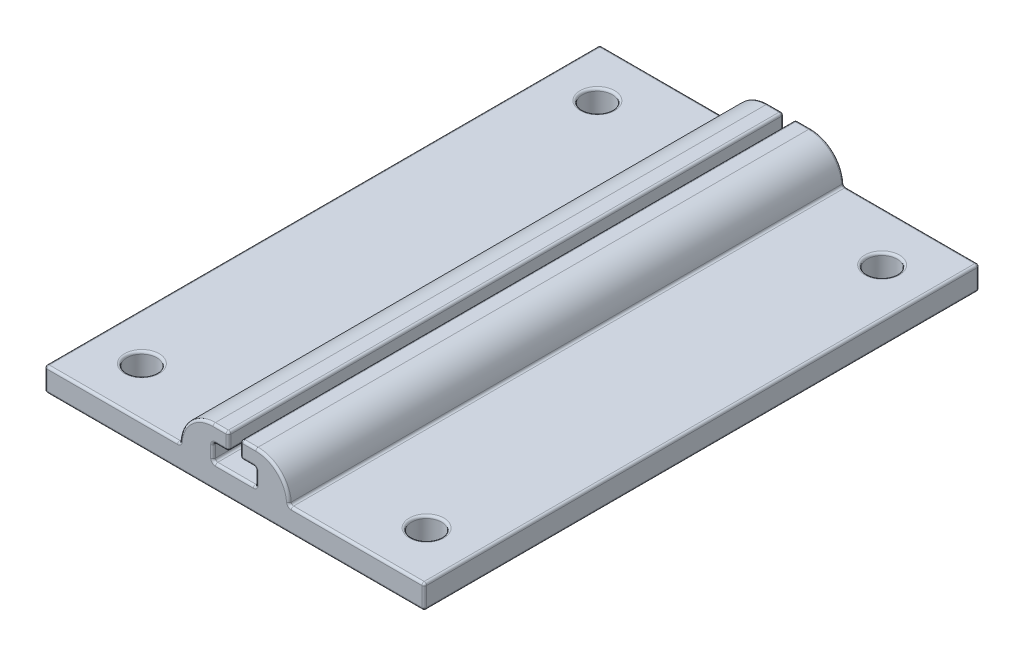
from build123d import *

# Parameters (mm, degrees)
BOSS_EXTRUDE1_DEPTH      = 58.5
BOSS_EXTRUDE1_DEPTH_BACK = 58.5
SKETCH2_R                = 3.15
CUT_EXTRUDE1_DEPTH       = 58.5
FILLET1_R                = 0.5


with BuildPart() as part:
    # Sketch1 → Boss-Extrude1 (new, two sides: drawn at the far end of the back side and taken through both)
    with BuildSketch(Plane.XY.offset(-BOSS_EXTRUDE1_DEPTH_BACK)):
        with BuildLine():
            Line((-40, -2.5), (40, -2.5))
            Line((40, -2.5), (40, 2.5))
            Line((40, 2.5), (11.5, 2.5))
            ThreePointArc((11.5, 2.5), (9.449747468, 7.449747468), (4.5, 9.5))
            Line((4.5, 9.5), (1.25, 9.5))
            Line((1.25, 9.5), (1.25, 6))
            Line((1.25, 6), (4.5, 6))
            Line((4.5, 6), (4.5, 2.5))
            Line((4.5, 2.5), (-4.5, 2.5))
            Line((-4.5, 2.5), (-4.5, 6))
            Line((-4.5, 6), (-1.25, 6))
            Line((-1.25, 6), (-1.25, 9.5))
            Line((-1.25, 9.5), (-4.5, 9.5))
            ThreePointArc((-4.5, 9.5), (-9.449747468, 7.449747468), (-11.5, 2.5))
            Line((-11.5, 2.5), (-40, 2.5))
            Line((-40, 2.5), (-40, -2.5))
        make_face()
    extrude(amount=BOSS_EXTRUDE1_DEPTH + BOSS_EXTRUDE1_DEPTH_BACK)

    # Sketch2 → Cut-Extrude1 (cut)
    with BuildSketch(Plane.XZ.offset(2.5)):
        with Locations((-30, 48)):
            Circle(SKETCH2_R)
        with Locations((30, 48)):
            Circle(SKETCH2_R)
        with Locations((30, -48)):
            Circle(SKETCH2_R)
        with Locations((-30, -48)):
            Circle(SKETCH2_R)
    extrude(amount=-CUT_EXTRUDE1_DEPTH, mode=Mode.SUBTRACT)

    # Fillet1
    fillet1_edges = [part.edges().sort_by_distance(p)[0] for p in [
        (40, -2.5, 0),
        (-40, -2.5, 0),
        (-4.5, 6, 0),
        (-1.25, 6, 0),
        (-1.25, 9.5, 0),
        (1.25, 9.5, 0),
        (1.25, 6, 0),
        (4.5, 6, 0),
        (4.5, 2.5, 0),
        (-4.5, 2.5, 0),
        (-2.875, 6, -58.5),
        (-1.25, 7.75, -58.5),
        (-2.875, 9.5, -58.5),
        (-9.449747468, 7.449747468, -58.5),
        (-40, 0, -58.5),
        (0, -2.5, -58.5),
        (40, 0, -58.5),
        (9.449747468, 7.449747468, -58.5),
        (2.875, 9.5, -58.5),
        (1.25, 7.75, -58.5),
        (2.875, 6, -58.5),
        (4.5, 4.25, -58.5),
        (0, 2.5, -58.5),
        (-4.5, 4.25, -58.5),
        (0, 2.5, 58.5),
        (4.5, 4.25, 58.5),
        (2.875, 6, 58.5),
        (1.25, 7.75, 58.5),
        (2.875, 9.5, 58.5),
        (9.449747468, 7.449747468, 58.5),
        (40, 0, 58.5),
        (0, -2.5, 58.5),
        (-40, 0, 58.5),
        (-9.449747468, 7.449747468, 58.5),
        (-2.875, 9.5, 58.5),
        (-1.25, 7.75, 58.5),
        (-2.875, 6, 58.5),
        (-4.5, 4.25, 58.5),
        (-25.75, 2.5, -58.5),
        (-11.5, 2.5, 0),
        (-25.75, 2.5, 58.5),
        (-40, 2.5, 0),
        (-33.15, 2.5, -48),
        (-33.15, 2.5, 48),
        (25.75, 2.5, -58.5),
        (40, 2.5, 0),
        (25.75, 2.5, 58.5),
        (11.5, 2.5, 0),
        (26.85, 2.5, 48),
        (26.85, 2.5, -48),
    ]]
    fillet(fillet1_edges, radius=FILLET1_R)


solid = part.part
